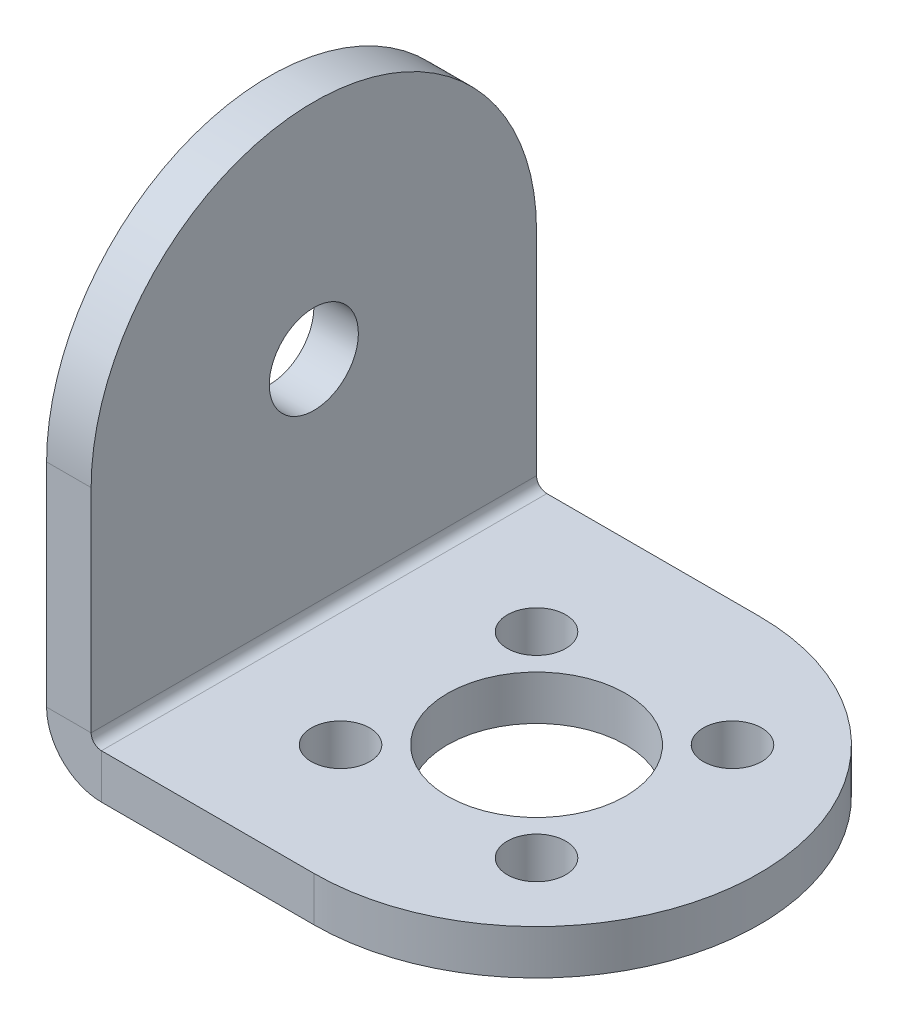
from build123d import *

# Parameters (mm, degrees)
BASE_FLANGE1_DEPTH = 15.875
FILLET1_RADIUS     = 15.875
FILLET1_LENGTH     = 3.175
FILLET2_RADIUS     = 15.875
FILLET2_LENGTH     = 3.175
SKETCH6_R          = 3.175
CUT_EXTRUDE1_DEPTH = 48.625
SKETCH7_R          = 6.35
CUT_EXTRUDE2_DEPTH = 48.625
SKETCH8_R          = 2.0828
CUT_EXTRUDE3_DEPTH = 48.625


# Sheet-metal steps are written as plain solids
with BuildPart() as part:
    # Sketch1 → Base-Flange1 (new, symmetric)
    with BuildSketch(Plane.XY):
        with BuildLine():
            Line((0, 31.75), (0, 0.7366))
            ThreePointArc((0, 0.7366), (0.215745145, 0.215745145), (0.7366, 0))
            Line((0.7366, 0), (31.75, 0))
            Line((31.75, 0), (31.75, -3.175))
            Line((31.75, -3.175), (0.7366, -3.175))
            ThreePointArc((0.7366, -3.175), (-2.029318885, -2.029318885), (-3.175, 0.7366))
            Line((-3.175, 0.7366), (-3.175, 31.75))
            Line((-3.175, 31.75), (0, 31.75))
        make_face()
    extrude(amount=BASE_FLANGE1_DEPTH, both=True)

    # Fillet1: full round fillet: the end face becomes a half cylinder, R = half its width
    fillet1_face = Plane((-1.5875, 31.75, 0), x_dir=(1, 0, 0), z_dir=(0, 1, 0))  # on the end face: x along it, z out of the body
    fillet1_slab = fillet1_face.offset(-FILLET1_RADIUS / 2) * Box(FILLET1_LENGTH, 2 * FILLET1_RADIUS, FILLET1_RADIUS, mode=Mode.PRIVATE)  # the body's end, R deep
    fillet1_round = Plane((-1.5875, 15.875, 0), x_dir=(0, 1, 0), z_dir=(1, 0, 0)) * Cylinder(FILLET1_RADIUS, FILLET1_LENGTH, mode=Mode.PRIVATE)  # its axis R under the face
    add(fillet1_slab - fillet1_round, mode=Mode.SUBTRACT)

    # Fillet2: full round fillet: the end face becomes a half cylinder, R = half its width
    fillet2_face = Plane((31.75, -1.5875, 0), x_dir=(0, -1, 0), z_dir=(1, 0, 0))  # on the end face: x along it, z out of the body
    fillet2_slab = fillet2_face.offset(-FILLET2_RADIUS / 2) * Box(FILLET2_LENGTH, 2 * FILLET2_RADIUS, FILLET2_RADIUS, mode=Mode.PRIVATE)  # the body's end, R deep
    fillet2_round = Plane((15.875, -1.5875, 0), x_dir=(1, 0, 0), z_dir=(0, -1, 0)) * Cylinder(FILLET2_RADIUS, FILLET2_LENGTH, mode=Mode.PRIVATE)  # its axis R under the face
    add(fillet2_slab - fillet2_round, mode=Mode.SUBTRACT)

    # Sketch6 → Cut-Extrude1 (cut, through all)
    with BuildSketch(Plane(origin=(0, 0, 0), x_dir=(0, 0, -1), z_dir=(1, 0, 0))):
        with Locations(Location((0, 15.875, 0), (0, 0, 90))):
            Circle(SKETCH6_R)
    extrude(amount=-CUT_EXTRUDE1_DEPTH, mode=Mode.SUBTRACT)

    # Sketch7 → Cut-Extrude2 (cut, through all)
    with BuildSketch(Plane(origin=(0, 0, 0), x_dir=(1, 0, 0), z_dir=(0, 1, 0))):
        with Locations(Location((15.875, 0, 0), (0, 0, 270))):
            Circle(SKETCH7_R)
    extrude(amount=-CUT_EXTRUDE2_DEPTH, mode=Mode.SUBTRACT)

    # Sketch8 → Cut-Extrude3 (cut, through all)
    with BuildSketch(Plane(origin=(0, 0, 0), x_dir=(1, 0, 0), z_dir=(0, 1, 0))):
        with Locations(Location((22.86, -6.985, 0), (0, 0, 270))):
            Circle(SKETCH8_R)
        with Locations(Location((22.86, 6.985, 0), (0, 0, 270))):
            Circle(SKETCH8_R)
        with Locations(Location((8.89, 6.985, 0), (0, 0, 270))):
            Circle(SKETCH8_R)
        with Locations(Location((8.89, -6.985, 0), (0, 0, 270))):
            Circle(SKETCH8_R)
    extrude(amount=-CUT_EXTRUDE3_DEPTH, mode=Mode.SUBTRACT)


solid = part.part
